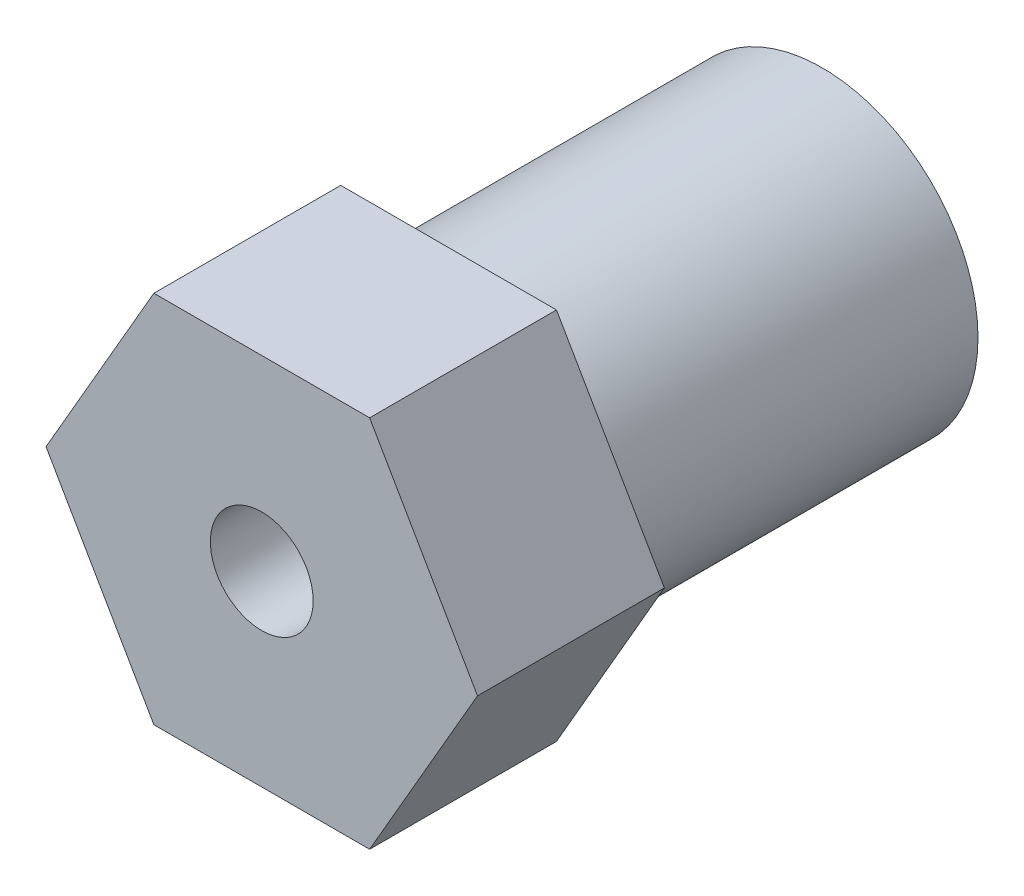
from build123d import *

# Parameters (mm, degrees)
BOSS_EXTRUDE1_DEPTH = 6
SKETCH2_R           = 5
BOSS_EXTRUDE2_DEPTH = 12
SKETCH3_R           = 2.5
CUT_EXTRUDE1_DEPTH  = 12
SKETCH4_R           = 1.65
CUT_EXTRUDE2_DEPTH  = 6
SKETCH5_R           = 1.25
CUT_EXTRUDE3_DEPTH  = 5.1


with BuildPart() as part:
    # Sketch1 → Boss-Extrude1 (new body)
    with BuildSketch(Plane.XY):
        Polygon((6.92820323, 0), (3.464101615, 6), (-3.464101615, 6), (-6.92820323, 0), (-3.464101615, -6), (3.464101615, -6), align=None)
    extrude(amount=BOSS_EXTRUDE1_DEPTH)

    # Sketch2 → Boss-Extrude2 (add)
    with BuildSketch(Plane.XY):
        Circle(SKETCH2_R)
    extrude(amount=-BOSS_EXTRUDE2_DEPTH)

    # Sketch3 → Cut-Extrude1 (cut)
    with BuildSketch(Plane.XY):
        Circle(SKETCH3_R)
    extrude(amount=-CUT_EXTRUDE1_DEPTH, mode=Mode.SUBTRACT)

    # Sketch4 → Cut-Extrude2 (cut)
    with BuildSketch(Plane.XY):
        Circle(SKETCH4_R)
    extrude(amount=CUT_EXTRUDE2_DEPTH, mode=Mode.SUBTRACT)

    # Sketch5 → Cut-Extrude3 (cut)
    with BuildSketch(Plane(origin=(0, 0, 0), x_dir=(1, 0, 0), z_dir=(0, 1, 0))):
        with Locations((0, 9)):
            Circle(SKETCH5_R)
    extrude(amount=-CUT_EXTRUDE3_DEPTH, mode=Mode.SUBTRACT)


solid = part.part
